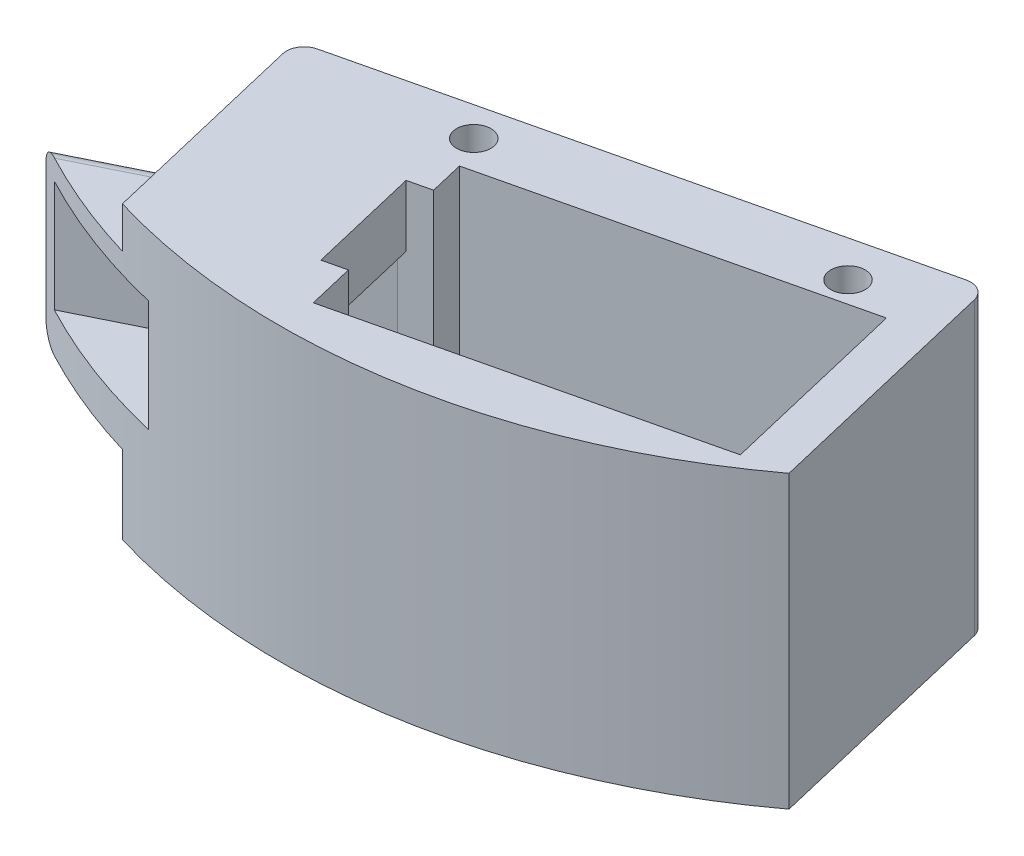
from build123d import *

# Parameters (mm, degrees)
BOSS_EXTRUDE1_DEPTH          = 41.656
CUT_EXTRUDE1_DEPTH           = 38.481
CUT_EXTRUDE2_START           = -28.8671
SKETCH11_W                   = 16.434556017
SKETCH11_H                   = 15.968225366
CUT_EXTRUDE2_DEPTH           = 7.62
SKETCH16_W                   = 24.568216569
SKETCH16_H                   = 19.806256701
BOSS_EXTRUDE3_DEPTH          = 53.34
CUT_EXTRUDE3_START           = -24.568216569
CUT_EXTRUDE3_DEPTH           = 24.568216569
SKETCH22_W                   = 16.862412739
SKETCH22_H                   = 15.968225366
CUT_EXTRUDE4_DEPTH           = 53.34
CUT_EXTRUDE6_DEPTH           = 119.901499034
F_10_0_1935_DIAMETER_HOLE1_D = 4.9149
CUT_EXTRUDE11_REACH          = 116.77
CUT_EXTRUDE9_DEPTH           = 112.875933154
FILLET2_R                    = 2.54
SKETCH34_W                   = 28.194
SKETCH34_H                   = 38.481
BOSS_EXTRUDE4_DEPTH          = 3.302


# Read off the part's stored shape, not the designer's step: Cut-Extrude3
with BuildPart() as part:
    # Sketch1 → Boss-Extrude1 (new body)
    with BuildSketch(Plane(origin=(0, 0, 0), x_dir=(1, 0, 0), z_dir=(0, 1, 0))):
        with BuildLine():
            Line((63.017839503, -66.782093), (53.468205472, -26.506342671))
            Line((53.468205472, -26.506342671), (-35.875703335, -47.690346072))
            Line((-35.875703335, -47.690346072), (-26.326069304, -87.966096401))
            ThreePointArc((-26.326069304, -87.966096401), (21.184003401, -89.343908807), (63.017839503, -66.782093))
        make_face()
    extrude(amount=BOSS_EXTRUDE1_DEPTH)

    # Sketch2 → Cut-Extrude1 (cut)
    with BuildSketch(Plane(origin=(0, 41.656, 0), x_dir=(1, 0, 0), z_dir=(0, 1, 0))):
        Polygon((19.413866358, -81.878324539), (52.259801297, -74.090346526), (45.755169548, -46.656947141), (-3.674378893, -58.377004348), (2.830252857, -85.810403732), align=None)
    extrude(amount=-CUT_EXTRUDE1_DEPTH, mode=Mode.SUBTRACT)

    # Sketch11 → Cut-Extrude2 (cut)
    with BuildSketch(Plane(origin=(-44.671954403, 0, 10.592001701), x_dir=(0.230709787533386, 0, 0.973022607104429), z_dir=(-0.973022607104429, 0, 0.230709787533386)).offset(CUT_EXTRUDE2_START)):
        with Locations((69.159923537, 24.869161711)):
            Rectangle(SKETCH11_W, SKETCH11_H)
    extrude(amount=CUT_EXTRUDE2_DEPTH, mode=Mode.SUBTRACT)

    # Sketch16 → Boss-Extrude3 (add)
    with BuildSketch(Plane(origin=(-33.786311583, 0, 16.678693854), x_dir=(0, -1, 0), z_dir=(0.8966923373350206, 0, -0.4426543258171746))):
        with Locations((-23.482416275, -61.32247831)):
            Rectangle(SKETCH16_W, SKETCH16_H)
    extrude(amount=-BOSS_EXTRUDE3_DEPTH)

    # Cut-Extrude3 outline → Cut-Extrude3 (cut)
    with BuildSketch(Plane(origin=(0, 35.766524559, 0), x_dir=(1, 0, 0), z_dir=(0, 1, 0)).offset(CUT_EXTRUDE3_START)):
        with BuildLine():
            Line((-50.087557959, -104.157331307), (-20.43350094, -89.518534843))
            ThreePointArc((-20.43350094, -89.518534843), (-33.301223909, -85.569413503), (-45.453344654, -79.781511021))
            Line((-45.453344654, -79.781511021), (-58.854883166, -86.397212692))
            Line((-58.854883166, -86.397212692), (-50.087557959, -104.157331307))
        make_face()
    extrude(amount=CUT_EXTRUDE3_DEPTH, mode=Mode.SUBTRACT)

    # Sketch22 → Cut-Extrude4 (cut)
    with BuildSketch(Plane(origin=(-33.786311583, 0, 16.678693854), x_dir=(-0.4426543258171747, 0, -0.8966923373350206), z_dir=(0.8966923373350207, 0, -0.44265432581717473))):
        with Locations((-62.30694919, 24.869161711)):
            Rectangle(SKETCH22_W, SKETCH22_H)
    extrude(amount=-CUT_EXTRUDE4_DEPTH, mode=Mode.SUBTRACT)

    # Sketch24 → Cut-Extrude6 (cut, through all)
    with BuildSketch(Plane(origin=(0, 41.656, 0), x_dir=(1, 0, 0), z_dir=(0, 1, 0))):
        Polygon((56.919592876, -82.490265238), (45.99293133, -36.406877021), (-47.298720085, -58.526915055), (-50.529685657, -44.900260642), (55.061086644, -19.864023596), (69.218713762, -79.574066225), align=None)
    extrude(amount=-CUT_EXTRUDE6_DEPTH, mode=Mode.SUBTRACT)

    # #10 (0.1935) Diameter Hole1 (through all)
    with Locations(Plane(origin=(0, 41.656, 0), x_dir=(1, 0, 0), z_dir=(0, 1, 0))):
        with Locations((-9.275051774, -54.705205641), (35.043117703, -45.428524284)):
            Hole(F_10_0_1935_DIAMETER_HOLE1_D / 2)

    # Cut-Extrude11: up to this face of the body (flat: up to its plane)
    cut_extrude11_end = Plane(part.part.faces().sort_by_distance((24.292711202, 3.175, 66.233675437))[0])
    # Sketch33 → Cut-Extrude11 (cut, up to the picked face)
    with BuildSketch(Plane(origin=(0, 41.656, 0), x_dir=(1, 0, 0), z_dir=(0, 1, 0)), mode=Mode.PRIVATE) as cut_extrude11_sk1:
        Polygon((-6.887299542, -59.138808066), (13.024531054, -54.417587641), (19.529162804, -81.850987026), (-0.382667792, -86.572207451), align=None)
    cut_extrude11_tool1 = split(extrude(cut_extrude11_sk1.sketch, amount=-CUT_EXTRUDE11_REACH, mode=Mode.PRIVATE), bisect_by=cut_extrude11_end, keep=Keep.BOTH, mode=Mode.PRIVATE)
    add(cut_extrude11_tool1.solids().sort_by(Axis((6.320932, 41.656, 70.494898), (0, -1, 0)))[0], mode=Mode.SUBTRACT)

    # Sketch30 → Cut-Extrude9 (cut, through all)
    with BuildSketch(Plane.XZ.offset(-32.853274394)):
        Polygon((-5.736469349, 63.992454746), (-1.944856422, 79.983649289), (-5.130071965, 80.738883952), (-8.921684892, 64.74768941), align=None)
    extrude(amount=-CUT_EXTRUDE9_DEPTH, mode=Mode.SUBTRACT)

    # Fillet2
    fillet2_edges = [part.edges().sort_by_distance(p)[0] for p in [
        (-34.051060037, 20.828, 55.385811433),
        (45.99293133, 20.828, 36.406877021),
        (-37.760453577, 11.19830799, 75.983896866),
        (-37.760453577, 35.766524559, 75.983896866),
    ]]
    fillet(fillet2_edges, radius=FILLET2_R)

    # Sketch34 → Boss-Extrude4 (add)
    with BuildSketch(Plane(origin=(32.845934939, 0, -7.787978014), x_dir=(0.23070978753338592, 0, 0.973022607104429), z_dir=(-0.9730226071044291, 0, 0.23070978753338595))):
        with Locations((70.051429791, 22.4155)):
            Rectangle(SKETCH34_W, SKETCH34_H)
    extrude(amount=BOSS_EXTRUDE4_DEPTH)


solid = part.part
